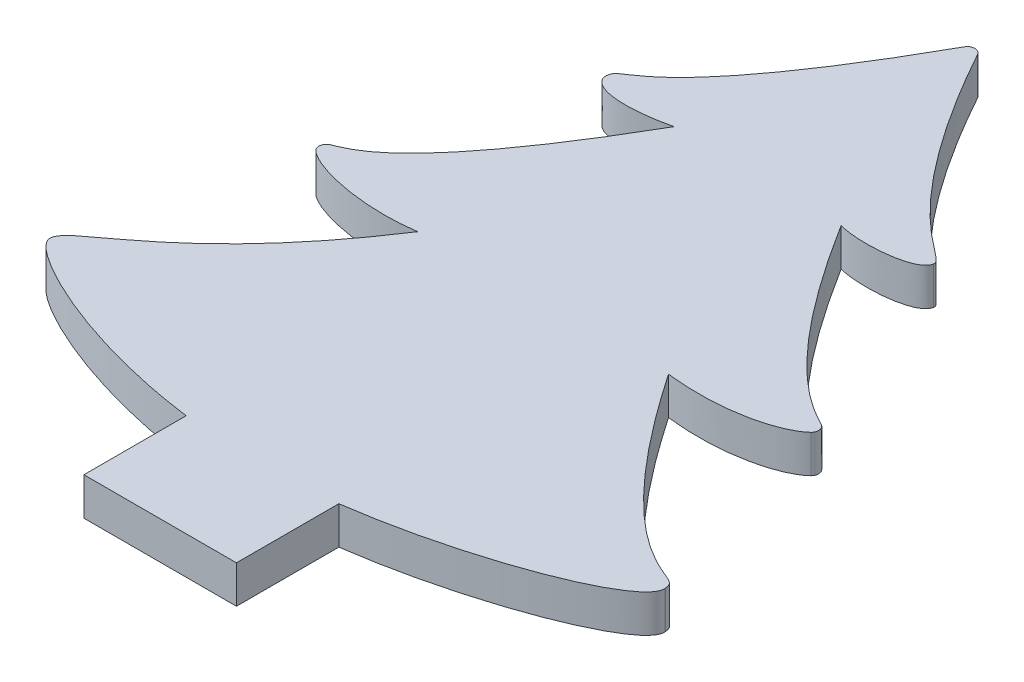
from build123d import *

# Parameters (mm, degrees)
BOSS_EXTRUDE1_DEPTH = 5
FILLET1_R           = 10
FILLET2_START       = -1
FILLET2_DEPTH       = 7
FILLET2_2_DEPTH     = 5
FILLET3_R           = 1
BOSS_EXTRUDE2_DEPTH = 5


with BuildPart() as part:
    # Sketch2 → Boss-Extrude1 (new body)
    with BuildSketch(Plane(origin=(0, 0, 0), x_dir=(1, 0, 0), z_dir=(0, 1, 0))):
        with BuildLine():
            add(Edge.make_bspline(
                [(-26.460947075, 51.114211153), (-12.427548014, 25.108493293), (-4.028423797, 24.103183764), (-4.41793616, 22.483556797)],
                knots=[0, 0, 0, 0, 1, 1, 1, 1], degree=3))
            add(Edge.make_bspline(
                [(-4.41793616, 22.483556797), (-4.887213543, 20.187029491), (-12.597975929, 19.976462624), (-14.992954401, 20.804801043)],
                knots=[0, 0, 0, 0, 1, 1, 1, 1], degree=3))
            add(Edge.make_bspline(
                [(-14.992954401, 20.804801043), (1.787270351, -6.103899351), (8.22123179, -2.127672237), (7.172892256, -4.601264311)],
                knots=[0, 0, 0, 0, 1, 1, 1, 1], degree=3))
            add(Edge.make_bspline(
                [(7.172892256, -4.601264311), (5.638367492, -6.681504252), (-0.799609665, -8.768183654), (-9.338641476, -7.791193384)],
                knots=[0, 0, 0, 0, 1, 1, 1, 1], degree=3))
            add(Edge.make_bspline(
                [(-9.338641476, -7.791193384), (8.962790554, -34.701758749), (15.02254586, -29.475085195), (15.060000948, -32.637388979)],
                knots=[0, 0, 0, 0, 1, 1, 1, 1], degree=3))
            add(Edge.make_bspline(
                [(-26.460947075, -45.261592135), (-9.676835521, -45.586760912), (15.687111692, -36.861745266), (15.060000948, -32.637388979)],
                knots=[0, 0, 0, 0, 1, 1, 1, 1], degree=3))
            add(Edge.make_bspline(
                [(-66.046301456, -33.30600061), (-65.977623625, -36.050325123), (-47.681674197, -45.288435387), (-26.460947075, -45.261592135)],
                knots=[0, 0, 0, 0, 1, 1, 1, 1], degree=3))
            add(Edge.make_bspline(
                [(-42.38194966, -8.050912304), (-55.265743099, -27.835283819), (-66.345571411, -30.483595462), (-66.046301456, -33.30600061)],
                knots=[0, 0, 0, 0, 1, 1, 1, 1], degree=3))
            add(Edge.make_bspline(
                [(-58.896340189, -4.69945124), (-59.030645987, -6.480678116), (-50.779962761, -9.251788646), (-42.38194966, -8.050912304)],
                knots=[0, 0, 0, 0, 1, 1, 1, 1], degree=3))
            add(Edge.make_bspline(
                [(-37.440614, 21.054048916), (-53.746480623, -7.348370101), (-58.646356675, -2.305720166), (-58.896340189, -4.69945124)],
                knots=[0, 0, 0, 0, 1, 1, 1, 1], degree=3))
            add(Edge.make_bspline(
                [(-47.800827469, 22.154310098), (-47.410404752, 20.188415441), (-42.93978555, 19.761395244), (-37.440614, 21.054048916)],
                knots=[0, 0, 0, 0, 1, 1, 1, 1], degree=3))
            add(Edge.make_bspline(
                [(-26.460947075, 51.114211153), (-43.28906286, 20.482524417), (-47.971844347, 25.301823121), (-47.800827469, 22.154310098)],
                knots=[0, 0, 0, 0, 1, 1, 1, 1], degree=3))
        make_face()
    extrude(amount=BOSS_EXTRUDE1_DEPTH)

    # Fillet1
    # the kernel refuses this fillet: 10 mm, written as the material it adds along each edge
    with BuildSketch(Plane(origin=(-26.460947075, 0, 45.261592135), x_dir=(0.9998301014874635, 0, 0.018432801186160547), z_dir=(0, 1, 0))) as fillet1_piece_1:
        with BuildLine():
            CenterArc((0.095571826, -9.99999563), FILLET1_R, 90.053566795, 1.005062424)
            ThreePointArc((-0.089183316, -0.001702498), (-0.044591398, -0.000864875), (0, 0))
            ThreePointArc((0, 0), (0.043111329, -2.0179e-05), (0.086222658, 0))
        make_face()
    extrude(amount=5)

    # Fillet2: read off the stored shape, not the designer's step
    # Fillet2 outline → Fillet2 (cut)
    with BuildSketch(Plane(origin=(0, 0, 0), x_dir=(1, 0, 0), z_dir=(0, 1, 0)).offset(FILLET2_START)):
        with BuildLine():
            add(Edge.make_bspline(
                [(-47.800827469, 22.154310098), (-47.787582934, 22.087619919), (-47.769642872, 22.022700691), (-47.747126417, 21.959559472)],
                knots=[0, 0, 0, 0, 0.033923577, 0.033923577, 0.033923577, 0.033923577], degree=3))
            ThreePointArc((-47.747126417, 21.959559472), (-47.789706131, 22.119961107), (-47.805171518, 22.285195905))
            add(Edge.make_bspline(
                [(-47.805171518, 22.285195905), (-47.80474027, 22.243126607), (-47.803285041, 22.199540953), (-47.800827469, 22.154310098)],
                knots=[0.985629653, 0.985629653, 0.985629653, 0.985629653, 1, 1, 1, 1], degree=3))
        make_face()
        with BuildLine():
            ThreePointArc((-58.480285024, -5.49409461), (-58.77681304, -4.607482629), (-58.211007375, -3.86325577))
            add(Edge.make_bspline(
                [(-58.211007375, -3.86325577), (-58.63585352, -4.060348609), (-58.849105033, -4.247148374), (-58.896340189, -4.69945124)],
                knots=[0.811046917, 0.811046917, 0.811046917, 0.811046917, 1, 1, 1, 1], degree=3))
            add(Edge.make_bspline(
                [(-58.896340189, -4.69945124), (-58.915187245, -4.949409799), (-58.768914163, -5.218861494), (-58.480285024, -5.49409461)],
                knots=[0, 0, 0, 0, 0.140329434, 0.140329434, 0.140329434, 0.140329434], degree=3))
        make_face()
        with BuildLine():
            ThreePointArc((6.603041154, -3.423142366), (7.103155792, -4.171777978), (6.798725932, -5.019063284))
            add(Edge.make_bspline(
                [(6.798725932, -5.019063284), (6.944949461, -4.880385824), (7.069953552, -4.740810579), (7.172892256, -4.601264311)],
                knots=[0.932918187, 0.932918187, 0.932918187, 0.932918187, 1, 1, 1, 1], degree=3))
            add(Edge.make_bspline(
                [(7.172892256, -4.601264311), (7.423474277, -4.01000768), (7.246561276, -3.787256085), (6.603041154, -3.423142366)],
                knots=[0, 0, 0, 0, 0.239027541, 0.239027541, 0.239027541, 0.239027541], degree=3))
        make_face()
    extrude(amount=FILLET2_DEPTH, mode=Mode.SUBTRACT)

    # Fillet2 2 outline → Fillet2 2 (add)
    with BuildSketch(Plane(origin=(0, 0, 0), x_dir=(1, 0, 0), z_dir=(0, 1, 0))):
        with BuildLine():
            add(Edge.make_bspline(
                [(-66.048164843, -33.286769384), (-66.047602355, -33.29317903), (-66.046981263, -33.299589371), (-66.046301456, -33.30600061)],
                knots=[0.997728448, 0.997728448, 0.997728448, 0.997728448, 1, 1, 1, 1], degree=3))
            ThreePointArc((-66.048164843, -33.286769384), (-66.04674894, -33.304768154), (-66.045658211, -33.322789552))
            add(Edge.make_bspline(
                [(-66.046301456, -33.30600061), (-66.046162074, -33.311570221), (-66.045947617, -33.317166579), (-66.045658211, -33.322789552)],
                knots=[0, 0, 0, 0, 0.002029502, 0.002029502, 0.002029502, 0.002029502], degree=3))
        make_face()
        with BuildLine():
            add(Edge.make_bspline(
                [(15.064825863, -32.674467974), (15.063438106, -32.662070244), (15.061830087, -32.649710467), (15.060000948, -32.637388979)],
                knots=[0.997083227, 0.997083227, 0.997083227, 0.997083227, 1, 1, 1, 1], degree=3))
            ThreePointArc((15.064825863, -32.674467974), (15.061134508, -32.634107801), (15.059081591, -32.593631201))
            add(Edge.make_bspline(
                [(15.060000948, -32.637388979), (15.059826038, -32.622621486), (15.059519797, -32.608036936), (15.059081591, -32.593631201)],
                knots=[0, 0, 0, 0, 0.004669853, 0.004669853, 0.004669853, 0.004669853], degree=3))
        make_face()
    extrude(amount=FILLET2_2_DEPTH)

    # Fillet3
    fillet3_edges = [part.edges().sort_by_distance(p)[0] for p in [
        (-26.460947075, 2.5, -51.114211153),
    ]]
    fillet(fillet3_edges, radius=FILLET3_R)

    # Sketch3 → Boss-Extrude2 (add)
    with BuildSketch(Plane(origin=(0, 5, 0), x_dir=(1, 0, 0), z_dir=(0, 1, 0))):
        Polygon((-36.595543758, -44.59706636), (-36.595543758, -58.179607966), (-16.334320806, -58.179607966), (-16.334320806, -44.578133049), align=None)
    extrude(amount=-BOSS_EXTRUDE2_DEPTH)


solid = part.part
